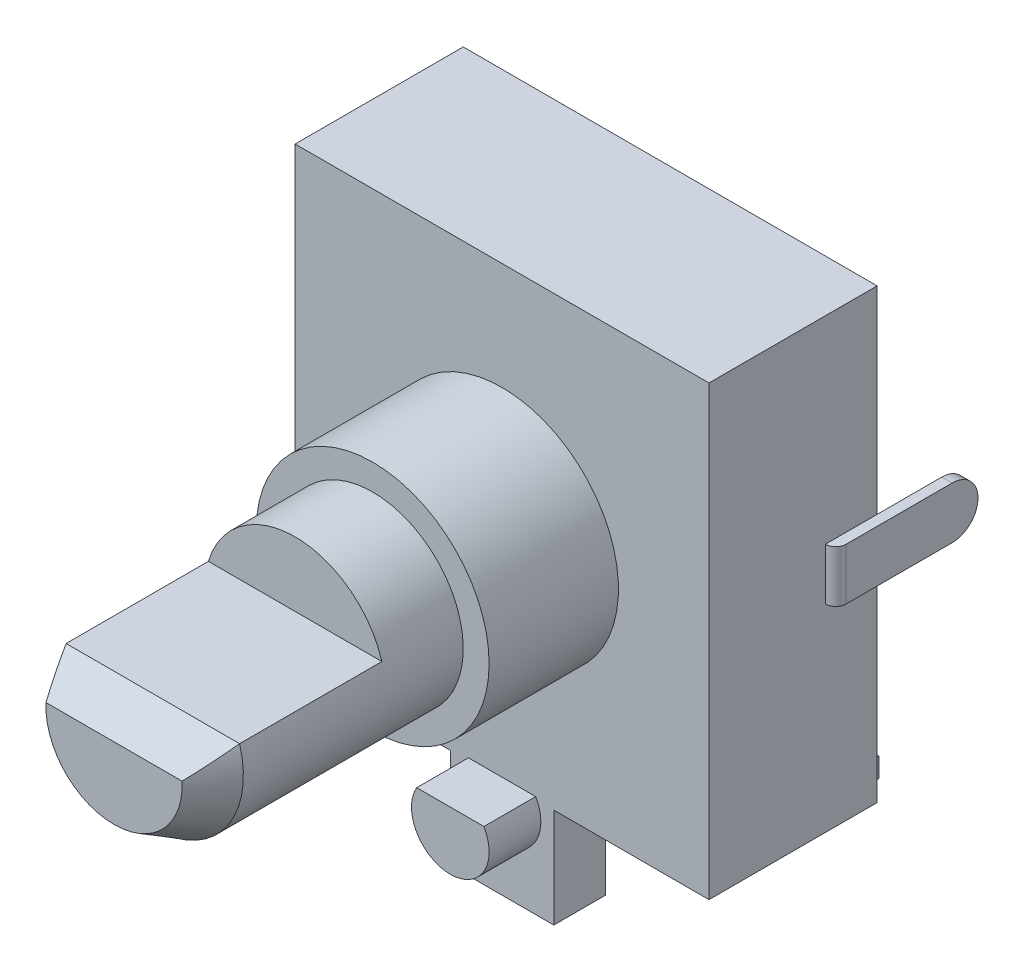
from build123d import *
from OCP.BRepFilletAPI import BRepFilletAPI_MakeChamfer

# Parameters (mm, degrees)
SKETCH1_W              = 16
SKETCH1_H              = 17.3
BOSS_EXTRUDE1_DEPTH    = 6.5
SKETCH2_W              = 4
SKETCH2_H              = 3.85
BOSS_EXTRUDE2_DEPTH    = 2
BOSS_EXTRUDE3_DEPTH    = 2
SKETCH4_R              = 4.5
BOSS_EXTRUDE4_DEPTH    = 5
SKETCH5_R              = 3.5
BOSS_EXTRUDE5_DEPTH    = 3
BOSS_EXTRUDE6_DEPTH    = 7
CHAMFER1_SIZE          = 1.5
CHAMFER1_SIZE2         = 0.866025404
SKETCH7_W              = 0.75
SKETCH7_H              = 1.85
BOSS_EXTRUDE7_DEPTH    = 1
SKETCH8_W              = 0.75
SKETCH8_H              = 0.75
BOSS_EXTRUDE8_DEPTH    = 3.7
FILLET1_R              = 0.4
LPATTERN1_COUNT        = 2
LPATTERN1_PITCH        = 5
FILLET1_OF_LPATTERN1_R = 0.4
MIRROR1_START          = 4.625
MIRROR1_DEPTH          = 0.75
SKETCH10_W             = 0.4
SKETCH10_H             = 2
BOSS_EXTRUDE9_DEPTH    = 5.5
FILLET2_R              = 0.4
FILLET3_R              = 1
FILLET2_OF_MIRROR2_R   = 0.4
FILLET3_OF_MIRROR2_R   = 1


# Read off the part's stored shape, not the designer's step: Mirror1
with BuildPart() as part:
    # Sketch1 → Boss-Extrude1 (new body)
    with BuildSketch(Plane.XY):
        Rectangle(SKETCH1_W, SKETCH1_H)
    extrude(amount=BOSS_EXTRUDE1_DEPTH)

    # Sketch2 → Boss-Extrude2 (add)
    with BuildSketch(Plane.XY.offset(6.5)):
        with Locations((0, -10.575)):
            Rectangle(SKETCH2_W, SKETCH2_H)
    extrude(amount=-BOSS_EXTRUDE2_DEPTH)

    # Sketch3 → Boss-Extrude3 (add)
    with BuildSketch(Plane.XY.offset(6.5)):
        with BuildLine():
            Line((-1.299038106, -8.55), (1.299038106, -8.55))
            ThreePointArc((1.299038106, -8.55), (0, -10.8), (-1.299038106, -8.55))
        make_face()
    extrude(amount=BOSS_EXTRUDE3_DEPTH)

    # Sketch4 → Boss-Extrude4 (add)
    with BuildSketch(Plane.XY.offset(6.5)):
        with Locations(Location((0, 0, 0), (0, 0, 180))):
            Circle(SKETCH4_R)
    extrude(amount=BOSS_EXTRUDE4_DEPTH)

    # Sketch5 → Boss-Extrude5 (add)
    with BuildSketch(Plane.XY.offset(11.5)):
        Circle(SKETCH5_R)
    extrude(amount=BOSS_EXTRUDE5_DEPTH)

    # Sketch6 → Boss-Extrude6 (add)
    with BuildSketch(Plane.XY.offset(14.5)):
        with BuildLine():
            Line((-3.354101966, 1), (3.354101966, 1))
            ThreePointArc((3.354101966, 1), (0, -3.5), (-3.354101966, 1))
        make_face()
    extrude(amount=BOSS_EXTRUDE6_DEPTH)

    # Chamfer1: one chamfer whose edges measure the first distance from different faces: ONE call of the kernel's chamfer builder (chamfer() names one face for all edges)
    chamfer1_edges_1 = [part.edges().sort_by_distance(p)[0] for p in [
        (0, -3.5, 21.5),
    ]]
    chamfer1_side_1 = [part.faces().sort_by_distance(p)[0] for p in [
        (0, -3.5, 18),
    ]]
    chamfer1_edges_2 = [part.edges().sort_by_distance(p)[0] for p in [
        (0, 1, 21.5),
    ]]
    chamfer1_side_2 = [part.faces().sort_by_distance(p)[0] for p in [
        (0, 1, 18),
    ]]
    chamfer1 = BRepFilletAPI_MakeChamfer(part.part.solid().wrapped)
    for e in chamfer1_edges_1:
        chamfer1.Add(CHAMFER1_SIZE, CHAMFER1_SIZE2, e.wrapped, chamfer1_side_1[0].wrapped)  # the first distance lies on this face
    for e in chamfer1_edges_2:
        chamfer1.Add(CHAMFER1_SIZE, CHAMFER1_SIZE2, e.wrapped, chamfer1_side_2[0].wrapped)  # the first distance lies on this face
    add(Compound.cast(chamfer1.Shape()), mode=Mode.REPLACE)

    # Sketch7 → Boss-Extrude7 (add)
    with BuildSketch(Plane(origin=(0, 0, 2), x_dir=(-1, 0, 0), z_dir=(0, 0, -1))):
        with Locations((0, -9.575)):
            Rectangle(SKETCH7_W, SKETCH7_H)
    boss_extrude7 = extrude(amount=BOSS_EXTRUDE7_DEPTH)

    # Sketch8 → Boss-Extrude8 (add)
    with BuildSketch(Plane(origin=(0, 0, 1), x_dir=(-1, 0, 0), z_dir=(0, 0, -1))):
        with Locations((0, -10.125)):
            Rectangle(SKETCH8_W, SKETCH8_H)
    boss_extrude8 = extrude(amount=BOSS_EXTRUDE8_DEPTH)

    # Fillet1
    fillet1_edges = [part.edges().sort_by_distance(p)[0] for p in [
        (0, -10.5, 2),
        (0, -9.75, 1),
    ]]
    fillet(fillet1_edges, radius=FILLET1_R)

    # LPattern1: Boss-Extrude7, Boss-Extrude8 ×2
    with Locations(*[(-i * LPATTERN1_PITCH, 0, 0) for i in range(1, LPATTERN1_COUNT)]):
        add(boss_extrude7)
        add(boss_extrude8)

    # Fillet1 of LPattern1
    fillet1_of_lpattern1_edges = [part.edges().sort_by_distance(p)[0] for p in [
        (-5, -10.5, 2),
        (-5, -9.75, 1),
    ]]
    fillet(fillet1_of_lpattern1_edges, radius=FILLET1_OF_LPATTERN1_R)

    # Mirror1 outline → Mirror1 (add)
    with BuildSketch(Plane.YZ.offset(MIRROR1_START)):
        with BuildLine():
            ThreePointArc((-9.75, 0.6), (-9.632842712, 0.882842712), (-9.35, 1))
            Line((-9.35, 1), (-8.65, 1))
            Line((-8.65, 1), (-8.65, 2))
            Line((-8.65, 2), (-10.1, 2))
            ThreePointArc((-10.1, 2), (-10.382842712, 1.882842712), (-10.5, 1.6))
            Line((-10.5, 1.6), (-10.5, -2.7))
            Line((-10.5, -2.7), (-9.75, -2.7))
            Line((-9.75, -2.7), (-9.75, 0.6))
        make_face()
    extrude(amount=MIRROR1_DEPTH)

    # Sketch10 → Boss-Extrude9 (add)
    with BuildSketch(Plane(origin=(0, 0, 2), x_dir=(-1, 0, 0), z_dir=(0, 0, -1))):
        with Locations((8.2, 0)):
            Rectangle(SKETCH10_W, SKETCH10_H)
    boss_extrude9 = extrude(amount=BOSS_EXTRUDE9_DEPTH)

    # Fillet2
    fillet2_edges = [part.edges().sort_by_distance(p)[0] for p in [
        (-8.4, 0, 2),
    ]]
    fillet(fillet2_edges, radius=FILLET2_R - 0.0001)  # a hair under: the kernel refuses the full size

    # Fillet3
    fillet3_edges = [part.edges().sort_by_distance(p)[0] for p in [
        (-8.2, 1, -3.5),
        (-8.2, -1, -3.5),
    ]]
    fillet(fillet3_edges, radius=FILLET3_R - 0.0001)  # a hair under: the kernel refuses the full size

    # Mirror2: Boss-Extrude9 across plane
    add(boss_extrude9.mirror(Plane.ZY))

    # Fillet2 of Mirror2
    fillet2_of_mirror2_edges = [part.edges().sort_by_distance(p)[0] for p in [
        (8.4, 0, 2),
    ]]
    fillet(fillet2_of_mirror2_edges, radius=FILLET2_OF_MIRROR2_R - 0.0001)  # a hair under: the kernel refuses the full size

    # Fillet3 of Mirror2
    fillet3_of_mirror2_edges = [part.edges().sort_by_distance(p)[0] for p in [
        (8.2, 1, -3.5),
        (8.2, -1, -3.5),
    ]]
    fillet(fillet3_of_mirror2_edges, radius=FILLET3_OF_MIRROR2_R - 0.0001)  # a hair under: the kernel refuses the full size


solid = part.part
